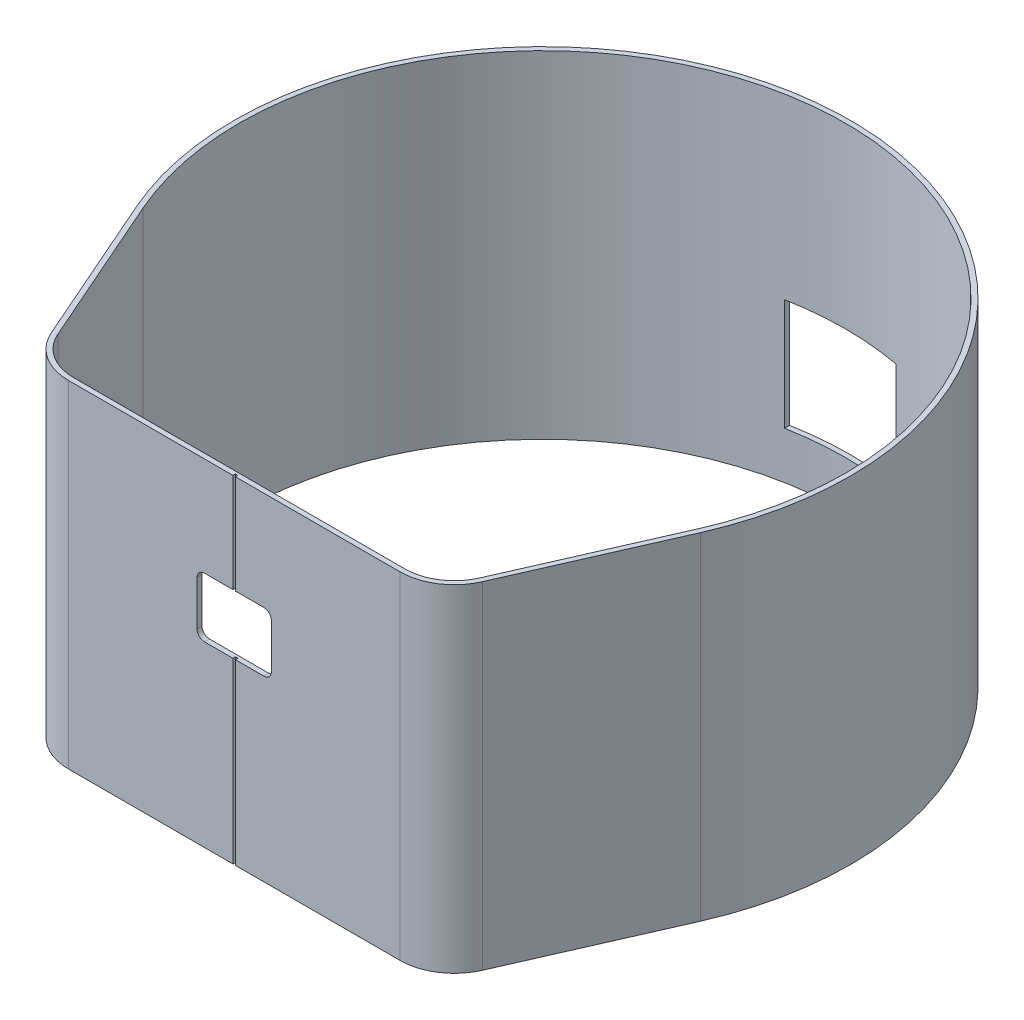
from build123d import *

# Parameters (mm, degrees)
BOSS_EXTRUDE1_DEPTH     = 90
CUT_EXTRUDE1_DEPTH      = 126.897279558
CUT_EXTRUDE1_DEPTH_BACK = 126.897279558
SKETCH2_W               = 124.715288327
SKETCH2_H               = 22
SKETCH4_W               = 22.5
SKETCH4_H               = 22.5
CUT_EXTRUDE3_DEPTH      = 126.897279558
CUT_EXTRUDE4_DEPTH      = 3
SKETCH6_W               = 0.5
SKETCH6_H               = 68
CUT_EXTRUDE5_DEPTH      = 0.5


with BuildPart() as part:
    # Sketch1 → Boss-Extrude1 (new body)
    with BuildSketch(Plane(origin=(0, 0, 0), x_dir=(1, 0, 0), z_dir=(0, 1, 0))):
        with BuildLine():
            ThreePointArc((33.469387755, -62.25), (39.484065665, -60.45997555), (43.541212573, -55.672481752))
            Line((43.541212573, -55.672481752), (56.997372263, -25.027226277))
            ThreePointArc((56.997372263, -25.027226277), (0, 62.25), (-56.997372263, -25.027226277))
            Line((-56.997372263, -25.027226277), (-43.541212573, -55.672481752))
            ThreePointArc((-43.541212573, -55.672481752), (-39.484065665, -60.45997555), (-33.469387755, -62.25))
            Line((-33.469387755, -62.25), (33.469387755, -62.25))
        make_face()
        with BuildLine():
            Line((-9.5e-08, -61.25), (-33.469387755, -61.25))
            ThreePointArc((-33.469387755, -61.25), (-38.937276764, -59.622705046), (-42.625592135, -55.270437956))
            Line((-42.625592135, -55.270437956), (-56.081751825, -24.625182482))
            ThreePointArc((-56.081751825, -24.625182482), (-12.580842594, 59.944014711), (61.25, 0))
            ThreePointArc((61.25, 0), (59.944014711, -12.580842594), (56.081751825, -24.625182482))
            Line((56.081751825, -24.625182482), (42.625592135, -55.270437956))
            ThreePointArc((42.625592135, -55.270437956), (38.937276764, -59.622705046), (33.469387755, -61.25))
            Line((33.469387755, -61.25), (-9.5e-08, -61.25))
        make_face(mode=Mode.SUBTRACT)
    extrude(amount=BOSS_EXTRUDE1_DEPTH)

    # Sketch2 → Cut-Extrude1 (cut, two sides: drawn at the far end of the back side and taken through both)
    with BuildSketch(Plane(origin=(0, 0, 0), x_dir=(0, 0, -1), z_dir=(1, 0, 0)).offset(-CUT_EXTRUDE1_DEPTH_BACK)):
        with Locations((-0.107644163, 11)):
            Rectangle(SKETCH2_W, SKETCH2_H)
    extrude(amount=CUT_EXTRUDE1_DEPTH + CUT_EXTRUDE1_DEPTH_BACK, mode=Mode.SUBTRACT)

    # Sketch4 → Cut-Extrude3 (cut, through all)
    with BuildSketch(Plane.XY):
        with Locations((0, 42.75)):
            Rectangle(SKETCH4_W, SKETCH4_H)
    extrude(amount=-CUT_EXTRUDE3_DEPTH, mode=Mode.SUBTRACT)

    # Sketch5 → Cut-Extrude4 (cut)
    with BuildSketch(Plane.XY.offset(62.25)):
        with BuildLine():
            Line((-6, 58), (6, 58))
            ThreePointArc((6, 58), (7.060660172, 58.439339828), (7.5, 59.5))
            Line((7.5, 59.5), (7.5, 68.5))
            ThreePointArc((7.5, 68.5), (7.060660172, 69.560660172), (6, 70))
            Line((6, 70), (-6, 70))
            ThreePointArc((-6, 70), (-7.060660172, 69.560660172), (-7.5, 68.5))
            Line((-7.5, 68.5), (-7.5, 59.5))
            ThreePointArc((-7.5, 59.5), (-7.060660172, 58.439339828), (-6, 58))
        make_face()
    extrude(amount=-CUT_EXTRUDE4_DEPTH, mode=Mode.SUBTRACT)

    # Sketch6 → Cut-Extrude5 (cut)
    with BuildSketch(Plane.XY.offset(62.25)):
        with Locations((0, 56)):
            Rectangle(SKETCH6_W, SKETCH6_H)
    extrude(amount=-CUT_EXTRUDE5_DEPTH, mode=Mode.SUBTRACT)


solid = part.part
